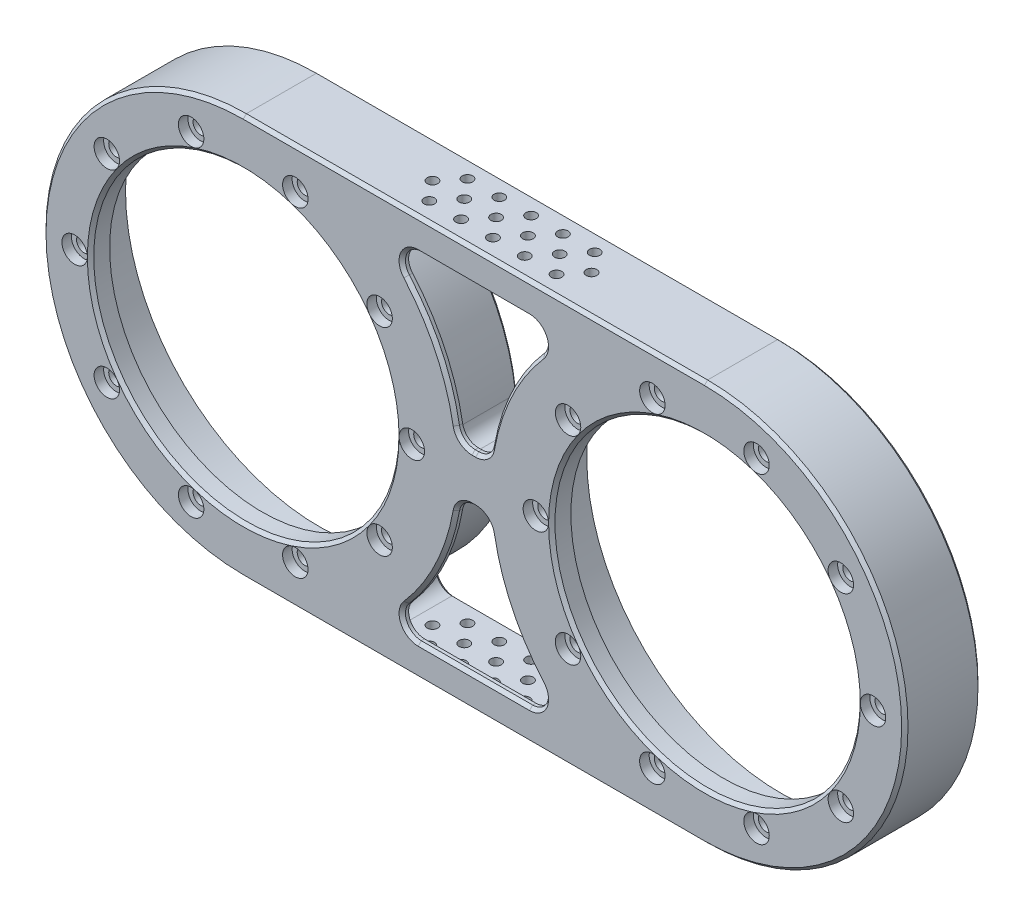
from build123d import *

# Parameters (mm, degrees)
SKETCH_1_R                   = 60
EXTRUDE_1_DEPTH              = 3
EXTRUDE_START                = 6
SKETCH_2_R                   = 48
EXTRUDE_2_DEPTH              = 6
SKETCH_3_R                   = 61
EXTRUDE_3_DEPTH              = 15
CUT_EXTRUDE_START            = -22
CUT_EXTRUDE_1_DEPTH          = 22
CUT_EXTRUDE_2_DEPTH          = 20
FILLET_2_R                   = 5
CHAMFER_2_SIZE               = 1
PATTERN_CIRCULAR_1_COUNT     = 10
PATTERN_CIRCULAR_2_COUNT     = 10
HOLE_WIZARD_M4_1_AT_2_COUNT  = 2
HOLE_WIZARD_M4_1_AT_2_PITCH  = 12
HOLE_WIZARD_M4_1_AT_3_COUNT  = 2
HOLE_WIZARD_M4_1_AT_3_PITCH  = 7.810249676
HOLE_WIZARD_M4_1_AT_4_COUNT  = 2
HOLE_WIZARD_M4_1_AT_4_PITCH  = 7.810249676
HOLE_WIZARD_M4_1_AT_5_COUNT  = 2
HOLE_WIZARD_M4_1_AT_5_PITCH  = 10
HOLE_WIZARD_M4_1_AT_6_COUNT  = 2
HOLE_WIZARD_M4_1_AT_6_PITCH  = 16.155494421
HOLE_WIZARD_M4_1_AT_7_COUNT  = 2
HOLE_WIZARD_M4_1_AT_7_PITCH  = 15.620499352
HOLE_WIZARD_M4_1_AT_8_COUNT  = 2
HOLE_WIZARD_M4_1_AT_8_PITCH  = 23.323807579
HOLE_WIZARD_M4_1_AT_9_COUNT  = 2
HOLE_WIZARD_M4_1_AT_9_PITCH  = 25.709920264
HOLE_WIZARD_M4_1_AT_10_COUNT = 2
HOLE_WIZARD_M4_1_AT_10_PITCH = 20
HOLE_WIZARD_M4_1_AT_11_COUNT = 2
HOLE_WIZARD_M4_1_AT_11_PITCH = 10
HOLE_WIZARD_M4_1_AT_12_COUNT = 2
HOLE_WIZARD_M4_1_AT_12_PITCH = 16.155494421
HOLE_WIZARD_M4_1_AT_13_COUNT = 2
HOLE_WIZARD_M4_1_AT_13_PITCH = 15.620499352
HOLE_WIZARD_M4_1_AT_14_COUNT = 2
HOLE_WIZARD_M4_1_AT_14_PITCH = 23.323807579
HOLE_WIZARD_M4_1_AT_15_COUNT = 2
HOLE_WIZARD_M4_1_AT_15_PITCH = 25.709920264
HOLE_WIZARD_M4_1_AT_16_COUNT = 2
HOLE_WIZARD_M4_1_AT_16_PITCH = 20


with BuildPart() as part:
    # 草图1 → 凸台-拉伸1 (new body)
    with BuildSketch(Plane.XY):
        with BuildLine():
            Line((0, 63), (145, 63))
            ThreePointArc((145, 63), (208, 0), (145, -63))
            Line((145, -63), (0, -63))
            ThreePointArc((0, -63), (-63, 0), (0, 63))
        make_face()
        Circle(SKETCH_1_R, mode=Mode.SUBTRACT)
        with Locations((145, 0)):
            Circle(SKETCH_1_R, mode=Mode.SUBTRACT)
    extrude(amount=-EXTRUDE_1_DEPTH)

    # 草图2 → 凸台-拉伸2 (add)
    with BuildSketch(Plane.XY.offset(EXTRUDE_START)):
        with BuildLine():
            Line((0, -63), (145, -63))
            ThreePointArc((145, -63), (208, 0), (145, 63))
            Line((145, 63), (0, 63))
            ThreePointArc((0, 63), (-63, 0), (0, -63))
        make_face()
        Circle(SKETCH_2_R, mode=Mode.SUBTRACT)
        with Locations((145, 0)):
            Circle(SKETCH_2_R, mode=Mode.SUBTRACT)
    extrude(amount=-EXTRUDE_2_DEPTH)

    # 草图3 → 凸台-拉伸3 (add)
    with BuildSketch(Plane(origin=(0, 0, -3), x_dir=(-1, 0, 0), z_dir=(0, 0, -1))):
        with BuildLine():
            Line((0, 63), (-145, 63))
            ThreePointArc((-145, 63), (-208, 0), (-145, -63))
            Line((-145, -63), (0, -63))
            ThreePointArc((0, -63), (63, 0), (0, 63))
        make_face()
        with Locations((-145, 0)):
            Circle(SKETCH_3_R, mode=Mode.SUBTRACT)
        Circle(SKETCH_3_R, mode=Mode.SUBTRACT)
    extrude(amount=EXTRUDE_3_DEPTH)

    # 草图4 → 切除-拉伸1 (cut)
    with BuildSketch(Plane(origin=(0, 0, -18), x_dir=(-1, 0, 0), z_dir=(0, 0, -1)).offset(CUT_EXTRUDE_START)):
        with BuildLine():
            ThreePointArc((-120.403252248, 58), (-93.171559203, 35.816375089), (-82.049622718, 2.5))
            Line((-82.049622718, 2.5), (-62.950377282, 2.5))
            ThreePointArc((-62.950377282, 2.5), (-51.828440797, 35.816375089), (-24.596747752, 58))
            Line((-24.596747752, 58), (-120.403252248, 58))
        make_face()
        with BuildLine():
            Line((-62.950377282, -2.5), (-82.049622718, -2.5))
            ThreePointArc((-82.049622718, -2.5), (-93.171559203, -35.816375089), (-120.403252248, -58))
            Line((-120.403252248, -58), (-24.596747752, -58))
            ThreePointArc((-24.596747752, -58), (-51.828440797, -35.816375089), (-62.950377282, -2.5))
        make_face()
    extrude(amount=CUT_EXTRUDE_1_DEPTH, mode=Mode.SUBTRACT)

    # 草图7 → 切除-拉伸2 (cut)
    with BuildSketch(Plane(origin=(0, 0, 4), x_dir=(-1, 0, 0), z_dir=(0, 0, -1))):
        with BuildLine():
            Line((-42.602816808, 53), (-102.397183192, 53))
            ThreePointArc((-102.397183192, 53), (-85.393721068, 32.72753446), (-77.414868499, 7.5))
            Line((-77.414868499, 7.5), (-67.585131501, 7.5))
            ThreePointArc((-67.585131501, 7.5), (-59.606278932, 32.72753446), (-42.602816808, 53))
        make_face()
        with BuildLine():
            Line((-67.585131501, -7.5), (-77.414868499, -7.5))
            ThreePointArc((-77.414868499, -7.5), (-85.393721068, -32.72753446), (-102.397183192, -53))
            Line((-102.397183192, -53), (-42.602816808, -53))
            ThreePointArc((-42.602816808, -53), (-59.606278932, -32.72753446), (-67.585131501, -7.5))
        make_face()
    extrude(amount=-CUT_EXTRUDE_2_DEPTH, mode=Mode.SUBTRACT)

    # 圆角2
    fillet_2_edges = [part.edges().sort_by_distance(p)[0] for p in [
        (42.602816808, 53, 5),
        (67.585131501, 7.5, 5),
        (77.414868499, 7.5, 5),
        (102.397183192, 53, 5),
        (24.596747752, 58, -7),
        (62.950377282, 2.5, -7),
        (82.049622718, 2.5, -7),
        (120.403252248, 58, -7),
        (62.950377282, -2.5, -7),
        (24.596747752, -58, -7),
        (120.403252248, -58, -7),
        (82.049622718, -2.5, -7),
        (67.585131501, -7.5, 5),
        (42.602816808, -53, 5),
        (102.397183192, -53, 5),
        (77.414868499, -7.5, 5),
    ]]
    fillet(fillet_2_edges, radius=FILLET_2_R)

    # 倒角2
    chamfer_2_edges = [part.edges().sort_by_distance(p)[0] for p in [
        (-60, 0, -3),
        (61.383052994, 29.259542121, 6),
        (72.5, 7.5, 6),
        (83.616947006, 29.259542121, 6),
        (61.383052994, -29.259542121, 6),
        (72.5, -53, 6),
        (83.616947006, -29.259542121, 6),
        (72.5, -7.5, 6),
        (72.5, 53, 6),
        (72.5, 2.5, -18),
        (89.776535695, 30.321098103, -18),
        (55.223464305, 30.321098103, -18),
        (72.5, 58, -18),
        (89.776535695, -30.321098103, -18),
        (72.5, -2.5, -18),
        (85, 0, -3),
        (72.5, -58, -18),
        (55.223464305, -30.321098103, -18),
        (68.703201021, 8.673721004, 6),
        (76.296798979, 8.673721004, 6),
        (50.448167613, -50.069014722, 6),
        (94.551832387, -50.069014722, 6),
        (76.296798979, -8.673721004, 6),
        (68.703201021, -8.673721004, 6),
        (50.448167613, 50.069014722, 6),
        (94.551832387, 50.069014722, 6),
        (80.749733343, 3.774590429, -18),
        (64.250266657, 3.774590429, -18),
        (37.886605717, 54.66052791, -18),
        (80.749733343, -3.774590429, -18),
        (107.113394283, -54.66052791, -18),
        (37.886605717, -54.66052791, -18),
        (64.250266657, -3.774590429, -18),
        (107.113394283, 54.66052791, -18),
        (-63, 0, 6),
        (72.5, -63, 6),
        (208, 0, 6),
        (72.5, 63, 6),
        (-48, 0, 6),
        (97, 0, 6),
        (-63, 0, -18),
        (72.5, 63, -18),
        (208, 0, -18),
        (72.5, -63, -18),
    ]]
    chamfer(chamfer_2_edges, length=CHAMFER_2_SIZE - 0.0001)  # a hair under: the kernel refuses the full size

    # 草图10 → 打孔尺寸(%根据)内六角圆柱头螺钉的类型1 (revolve, cut)
    with BuildSketch(Plane(origin=(198, 0, 6), x_dir=(0, -1, 0), z_dir=(1, 0, 0))):
        Polygon((0, 0), (0, 11.542065486), (2.4, 10.1), (2.4, 3), (4, 3), (4, 0), align=None)
    hole_wizard_1 = revolve(axis=Axis((198, 0, 12.35), (0, 0, -1)), mode=Mode.SUBTRACT)

    # 草图12 → 打孔尺寸(%根据)内六角圆柱头螺钉的类型2 (revolve, cut)
    with BuildSketch(Plane(origin=(53, 0, 6), x_dir=(0, -1, 0), z_dir=(1, 0, 0))):
        Polygon((0, 0), (0, 11.542065486), (2.4, 10.1), (2.4, 3), (4, 3), (4, 0), align=None)
    hole_wizard_2 = revolve(axis=Axis((53, 0, 12.35), (0, 0, -1)), mode=Mode.SUBTRACT)

    # 阵列(圆周)1: 打孔尺寸(%根据)内六角圆柱头螺钉的类型1 ×10 about axis
    pattern_circular_1_axis = Axis((145, 0, 0), (0, 0, 1))
    for i in range(1, PATTERN_CIRCULAR_1_COUNT):
        add(hole_wizard_1.rotate(pattern_circular_1_axis, i * 360 / PATTERN_CIRCULAR_1_COUNT), mode=Mode.SUBTRACT)

    # 阵列(圆周)2: 打孔尺寸(%根据)内六角圆柱头螺钉的类型2 ×10 about axis
    pattern_circular_2_axis = Axis((0, 0, 0), (0, 0, 1))
    for i in range(1, PATTERN_CIRCULAR_2_COUNT):
        add(hole_wizard_2.rotate(pattern_circular_2_axis, i * 360 / PATTERN_CIRCULAR_2_COUNT), mode=Mode.SUBTRACT)

    # 草图18 → M4 螺纹孔1 (revolve, cut)
    with BuildSketch(Plane(origin=(72.5, 63, -12), x_dir=(0, 0, 1), z_dir=(1, 0, 0))):
        Polygon((0, 0), (0, 11.091420021), (1.65, 10.1), (1.65, 0), align=None)
    hole_wizard_m4_1 = revolve(axis=Axis((72.5, 69.35, -12), (0, -1, 0)), mode=Mode.SUBTRACT)

    # M4 螺纹孔1 at 2: M4 螺纹孔1 ×2
    with Locations(*[(0, 0, i * HOLE_WIZARD_M4_1_AT_2_PITCH) for i in range(1, HOLE_WIZARD_M4_1_AT_2_COUNT)]):
        add(hole_wizard_m4_1, mode=Mode.SUBTRACT)

    # M4 螺纹孔1 at 3: M4 螺纹孔1 ×2
    with Locations(*[Vector(0.6401843996644799, 0, 0.7682212795973757) * (i * HOLE_WIZARD_M4_1_AT_3_PITCH) for i in range(1, HOLE_WIZARD_M4_1_AT_3_COUNT)]):
        add(hole_wizard_m4_1, mode=Mode.SUBTRACT)

    # M4 螺纹孔1 at 4: M4 螺纹孔1 ×2
    with Locations(*[Vector(-0.6401843996644809, 0, 0.768221279597375) * (i * HOLE_WIZARD_M4_1_AT_4_PITCH) for i in range(1, HOLE_WIZARD_M4_1_AT_4_COUNT)]):
        add(hole_wizard_m4_1, mode=Mode.SUBTRACT)

    # M4 螺纹孔1 at 5: M4 螺纹孔1 ×2
    with Locations(*[(-i * HOLE_WIZARD_M4_1_AT_5_PITCH, 0, 0) for i in range(1, HOLE_WIZARD_M4_1_AT_5_COUNT)]):
        add(hole_wizard_m4_1, mode=Mode.SUBTRACT)

    # M4 螺纹孔1 at 6: M4 螺纹孔1 ×2
    with Locations(*[Vector(-0.9284766908852594, 0, 0.3713906763541038) * (i * HOLE_WIZARD_M4_1_AT_6_PITCH) for i in range(1, HOLE_WIZARD_M4_1_AT_6_COUNT)]):
        add(hole_wizard_m4_1, mode=Mode.SUBTRACT)

    # M4 螺纹孔1 at 7: M4 螺纹孔1 ×2
    with Locations(*[Vector(-0.6401843996644804, 0, 0.7682212795973755) * (i * HOLE_WIZARD_M4_1_AT_7_PITCH) for i in range(1, HOLE_WIZARD_M4_1_AT_7_COUNT)]):
        add(hole_wizard_m4_1, mode=Mode.SUBTRACT)

    # M4 螺纹孔1 at 8: M4 螺纹孔1 ×2
    with Locations(*[Vector(-0.8574929257125442, 0, 0.5144957554275265) * (i * HOLE_WIZARD_M4_1_AT_8_PITCH) for i in range(1, HOLE_WIZARD_M4_1_AT_8_COUNT)]):
        add(hole_wizard_m4_1, mode=Mode.SUBTRACT)

    # M4 螺纹孔1 at 9: M4 螺纹孔1 ×2
    with Locations(*[Vector(-0.9723873019805175, 0, 0.23337295247532414) * (i * HOLE_WIZARD_M4_1_AT_9_PITCH) for i in range(1, HOLE_WIZARD_M4_1_AT_9_COUNT)]):
        add(hole_wizard_m4_1, mode=Mode.SUBTRACT)

    # M4 螺纹孔1 at 10: M4 螺纹孔1 ×2
    with Locations(*[(-i * HOLE_WIZARD_M4_1_AT_10_PITCH, 0, 0) for i in range(1, HOLE_WIZARD_M4_1_AT_10_COUNT)]):
        add(hole_wizard_m4_1, mode=Mode.SUBTRACT)

    # M4 螺纹孔1 at 11: M4 螺纹孔1 ×2
    with Locations(*[(i * HOLE_WIZARD_M4_1_AT_11_PITCH, 0, 0) for i in range(1, HOLE_WIZARD_M4_1_AT_11_COUNT)]):
        add(hole_wizard_m4_1, mode=Mode.SUBTRACT)

    # M4 螺纹孔1 at 12: M4 螺纹孔1 ×2
    with Locations(*[Vector(0.9284766908852594, 0, 0.37139067635410344) * (i * HOLE_WIZARD_M4_1_AT_12_PITCH) for i in range(1, HOLE_WIZARD_M4_1_AT_12_COUNT)]):
        add(hole_wizard_m4_1, mode=Mode.SUBTRACT)

    # M4 螺纹孔1 at 13: M4 螺纹孔1 ×2
    with Locations(*[Vector(0.6401843996644798, 0, 0.768221279597376) * (i * HOLE_WIZARD_M4_1_AT_13_PITCH) for i in range(1, HOLE_WIZARD_M4_1_AT_13_COUNT)]):
        add(hole_wizard_m4_1, mode=Mode.SUBTRACT)

    # M4 螺纹孔1 at 14: M4 螺纹孔1 ×2
    with Locations(*[Vector(0.8574929257125442, 0, 0.5144957554275267) * (i * HOLE_WIZARD_M4_1_AT_14_PITCH) for i in range(1, HOLE_WIZARD_M4_1_AT_14_COUNT)]):
        add(hole_wizard_m4_1, mode=Mode.SUBTRACT)

    # M4 螺纹孔1 at 15: M4 螺纹孔1 ×2
    with Locations(*[Vector(0.9723873019805176, 0, 0.23337295247532397) * (i * HOLE_WIZARD_M4_1_AT_15_PITCH) for i in range(1, HOLE_WIZARD_M4_1_AT_15_COUNT)]):
        add(hole_wizard_m4_1, mode=Mode.SUBTRACT)

    # M4 螺纹孔1 at 16: M4 螺纹孔1 ×2
    with Locations(*[(i * HOLE_WIZARD_M4_1_AT_16_PITCH, 0, 0) for i in range(1, HOLE_WIZARD_M4_1_AT_16_COUNT)]):
        add(hole_wizard_m4_1, mode=Mode.SUBTRACT)

    # 镜向1: M4 螺纹孔1 across plane
    add(hole_wizard_m4_1.mirror(Plane.ZX), mode=Mode.SUBTRACT)

    # 镜向1 copy 1 sketch → 镜向1 copy 1 (revolve, cut)
    with BuildSketch(Plane(origin=(72.5, -63, 0), x_dir=(0, 0, 1), z_dir=(1, 0, 0))):
        Polygon((0, 0), (0, -11.091420021), (1.65, -10.1), (1.65, 0), align=None)
    revolve(axis=Axis((72.5, -69.35, 0), (0, -1, 0)), mode=Mode.SUBTRACT)

    # 镜向1 copy 2 sketch → 镜向1 copy 2 (revolve, cut)
    with BuildSketch(Plane(origin=(77.5, -63, -6), x_dir=(0, 0, 1), z_dir=(1, 0, 0))):
        Polygon((0, 0), (0, -11.091420021), (1.65, -10.1), (1.65, 0), align=None)
    revolve(axis=Axis((77.5, -69.35, -6), (0, -1, 0)), mode=Mode.SUBTRACT)

    # 镜向1 copy 3 sketch → 镜向1 copy 3 (revolve, cut)
    with BuildSketch(Plane(origin=(67.5, -63, -6), x_dir=(0, 0, 1), z_dir=(1, 0, 0))):
        Polygon((0, 0), (0, -11.091420021), (1.65, -10.1), (1.65, 0), align=None)
    revolve(axis=Axis((67.5, -69.35, -6), (0, -1, 0)), mode=Mode.SUBTRACT)

    # 镜向1 copy 4 sketch → 镜向1 copy 4 (revolve, cut)
    with BuildSketch(Plane(origin=(62.5, -63, -12), x_dir=(0, 0, 1), z_dir=(1, 0, 0))):
        Polygon((0, 0), (0, -11.091420021), (1.65, -10.1), (1.65, 0), align=None)
    revolve(axis=Axis((62.5, -69.35, -12), (0, -1, 0)), mode=Mode.SUBTRACT)

    # 镜向1 copy 5 sketch → 镜向1 copy 5 (revolve, cut)
    with BuildSketch(Plane(origin=(57.5, -63, -6), x_dir=(0, 0, 1), z_dir=(1, 0, 0))):
        Polygon((0, 0), (0, -11.091420021), (1.65, -10.1), (1.65, 0), align=None)
    revolve(axis=Axis((57.5, -69.35, -6), (0, -1, 0)), mode=Mode.SUBTRACT)

    # 镜向1 copy 6 sketch → 镜向1 copy 6 (revolve, cut)
    with BuildSketch(Plane(origin=(62.5, -63, 0), x_dir=(0, 0, 1), z_dir=(1, 0, 0))):
        Polygon((0, 0), (0, -11.091420021), (1.65, -10.1), (1.65, 0), align=None)
    revolve(axis=Axis((62.5, -69.35, 0), (0, -1, 0)), mode=Mode.SUBTRACT)

    # 镜向1 copy 7 sketch → 镜向1 copy 7 (revolve, cut)
    with BuildSketch(Plane(origin=(52.5, -63, 0), x_dir=(0, 0, 1), z_dir=(1, 0, 0))):
        Polygon((0, 0), (0, -11.091420021), (1.65, -10.1), (1.65, 0), align=None)
    revolve(axis=Axis((52.5, -69.35, 0), (0, -1, 0)), mode=Mode.SUBTRACT)

    # 镜向1 copy 8 sketch → 镜向1 copy 8 (revolve, cut)
    with BuildSketch(Plane(origin=(47.5, -63, -6), x_dir=(0, 0, 1), z_dir=(1, 0, 0))):
        Polygon((0, 0), (0, -11.091420021), (1.65, -10.1), (1.65, 0), align=None)
    revolve(axis=Axis((47.5, -69.35, -6), (0, -1, 0)), mode=Mode.SUBTRACT)

    # 镜向1 copy 9 sketch → 镜向1 copy 9 (revolve, cut)
    with BuildSketch(Plane(origin=(52.5, -63, -12), x_dir=(0, 0, 1), z_dir=(1, 0, 0))):
        Polygon((0, 0), (0, -11.091420021), (1.65, -10.1), (1.65, 0), align=None)
    revolve(axis=Axis((52.5, -69.35, -12), (0, -1, 0)), mode=Mode.SUBTRACT)

    # 镜向1 copy 10 sketch → 镜向1 copy 10 (revolve, cut)
    with BuildSketch(Plane(origin=(82.5, -63, -12), x_dir=(0, 0, 1), z_dir=(1, 0, 0))):
        Polygon((0, 0), (0, -11.091420021), (1.65, -10.1), (1.65, 0), align=None)
    revolve(axis=Axis((82.5, -69.35, -12), (0, -1, 0)), mode=Mode.SUBTRACT)

    # 镜向1 copy 11 sketch → 镜向1 copy 11 (revolve, cut)
    with BuildSketch(Plane(origin=(87.5, -63, -6), x_dir=(0, 0, 1), z_dir=(1, 0, 0))):
        Polygon((0, 0), (0, -11.091420021), (1.65, -10.1), (1.65, 0), align=None)
    revolve(axis=Axis((87.5, -69.35, -6), (0, -1, 0)), mode=Mode.SUBTRACT)

    # 镜向1 copy 12 sketch → 镜向1 copy 12 (revolve, cut)
    with BuildSketch(Plane(origin=(82.5, -63, 0), x_dir=(0, 0, 1), z_dir=(1, 0, 0))):
        Polygon((0, 0), (0, -11.091420021), (1.65, -10.1), (1.65, 0), align=None)
    revolve(axis=Axis((82.5, -69.35, 0), (0, -1, 0)), mode=Mode.SUBTRACT)

    # 镜向1 copy 13 sketch → 镜向1 copy 13 (revolve, cut)
    with BuildSketch(Plane(origin=(92.5, -63, 0), x_dir=(0, 0, 1), z_dir=(1, 0, 0))):
        Polygon((0, 0), (0, -11.091420021), (1.65, -10.1), (1.65, 0), align=None)
    revolve(axis=Axis((92.5, -69.35, 0), (0, -1, 0)), mode=Mode.SUBTRACT)

    # 镜向1 copy 14 sketch → 镜向1 copy 14 (revolve, cut)
    with BuildSketch(Plane(origin=(97.5, -63, -6), x_dir=(0, 0, 1), z_dir=(1, 0, 0))):
        Polygon((0, 0), (0, -11.091420021), (1.65, -10.1), (1.65, 0), align=None)
    revolve(axis=Axis((97.5, -69.35, -6), (0, -1, 0)), mode=Mode.SUBTRACT)

    # 镜向1 copy 15 sketch → 镜向1 copy 15 (revolve, cut)
    with BuildSketch(Plane(origin=(92.5, -63, -12), x_dir=(0, 0, 1), z_dir=(1, 0, 0))):
        Polygon((0, 0), (0, -11.091420021), (1.65, -10.1), (1.65, 0), align=None)
    revolve(axis=Axis((92.5, -69.35, -12), (0, -1, 0)), mode=Mode.SUBTRACT)


solid = part.part
